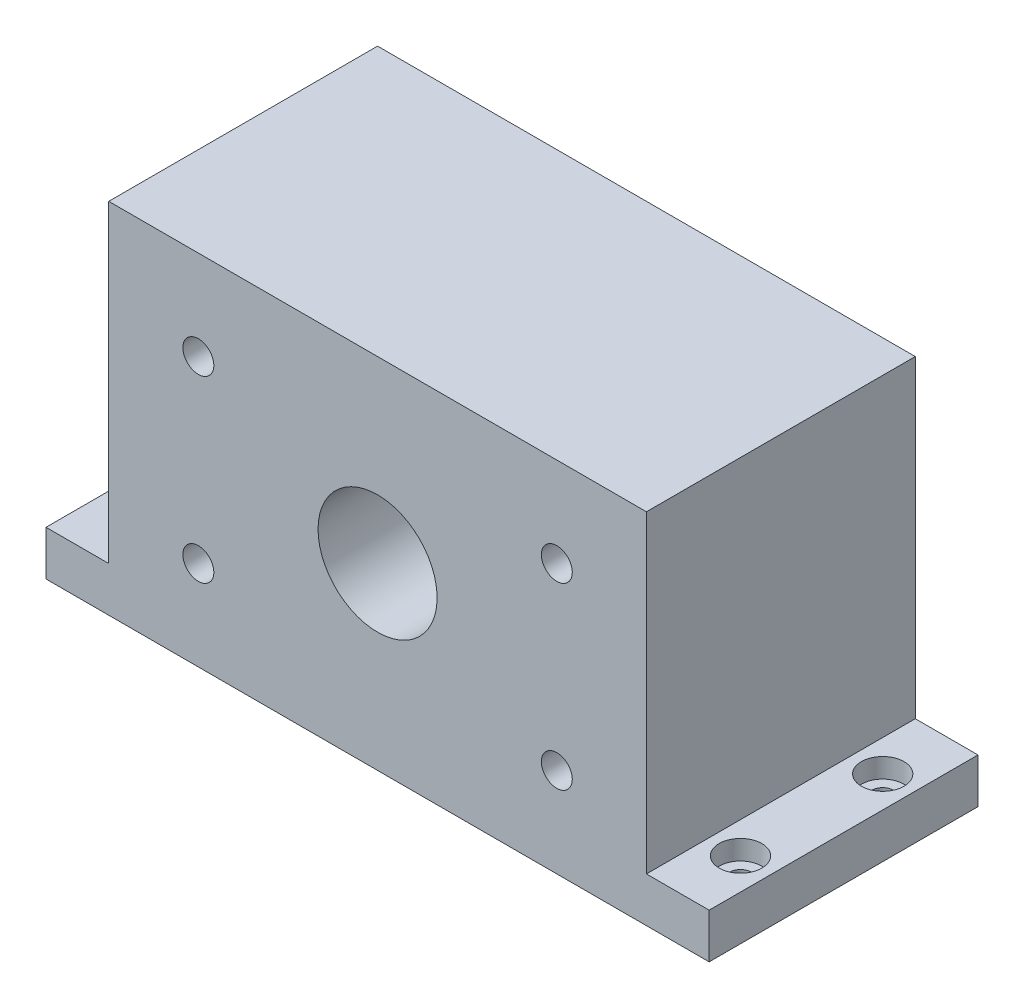
from build123d import *

# Parameters (mm, degrees)
SKETCH5_W                                      = 60
SKETCH5_H                                      = 30
BOSS_EXTRUDE3_DEPTH                            = 40
SKETCH7_W                                      = 40
SKETCH7_H                                      = 20
CUT_EXTRUDE1_DEPTH                             = 15
FILLET1_R                                      = 3
FILLET2_R                                      = 3
FILLET3_R                                      = 3
FILLET4_R                                      = 3
SKETCH9_W                                      = 30
SKETCH9_H                                      = 5
BOSS_EXTRUDE4_DEPTH                            = 7
SKETCH10_W                                     = 30
SKETCH10_H                                     = 5
BOSS_EXTRUDE5_DEPTH                            = 7
SKETCH12_R                                     = 2
CUT_EXTRUDE2_DEPTH                             = 10
SKETCH13_W                                     = 64
SKETCH13_H                                     = 20
CUT_EXTRUDE3_DEPTH                             = 1.5
CBORE_FOR_2_SOCKET_HEAD_CAP_SCREW1_D           = 2.4384
CBORE_FOR_2_SOCKET_HEAD_CAP_SCREW1_DEPTH       = 15
CBORE_FOR_2_SOCKET_HEAD_CAP_SCREW1_CBORE_D     = 4.7625
CBORE_FOR_2_SOCKET_HEAD_CAP_SCREW1_CBORE_DEPTH = 2.1844
CBORE_FOR_2_SOCKET_HEAD_CAP_SCREW1_TIP         = 0.732569267
F_2_56_TAPPED_HOLE2_D                          = 1.778
F_2_56_TAPPED_HOLE2_DEPTH                      = 15
F_2_56_TAPPED_HOLE2_TIP                        = 0.53416509
F_2_56_TAPPED_HOLE3_D                          = 1.778
F_2_56_TAPPED_HOLE3_DEPTH                      = 15
F_2_56_TAPPED_HOLE3_TIP                        = 0.53416509
CBORE_FOR_2_SOCKET_HEAD_CAP_SCREW3_D           = 2.4384
CBORE_FOR_2_SOCKET_HEAD_CAP_SCREW3_DEPTH       = 15
CBORE_FOR_2_SOCKET_HEAD_CAP_SCREW3_CBORE_D     = 4.7625
CBORE_FOR_2_SOCKET_HEAD_CAP_SCREW3_CBORE_DEPTH = 2.1844
CBORE_FOR_2_SOCKET_HEAD_CAP_SCREW3_TIP         = 0.732569267
F_8_32_TAPPED_HOLE1_D                          = 3.4544
F_8_32_TAPPED_HOLE1_DEPTH                      = 11
F_8_32_TAPPED_HOLE1_TIP                        = 1.037806461
F_0_535_40_TAPPED_HOLE1_D                      = 13.2842
SKETCH30_R                                     = 1.5
SKETCH30_R_2                                   = 3
CUT_EXTRUDE5_DEPTH                             = 10


with BuildPart() as part:
    # Sketch5 → Boss-Extrude3 (new body)
    with BuildSketch(Plane(origin=(0, 0, 0), x_dir=(1, 0, 0), z_dir=(0, 1, 0))):
        Rectangle(SKETCH5_W, SKETCH5_H)
    extrude(amount=BOSS_EXTRUDE3_DEPTH)

    # Sketch7 → Cut-Extrude1 (cut)
    with BuildSketch(Plane(origin=(0, 0, -15), x_dir=(-1, 0, 0), z_dir=(0, 0, -1))):
        with Locations((0, 20)):
            Rectangle(SKETCH7_W, SKETCH7_H)
    extrude(amount=-CUT_EXTRUDE1_DEPTH, mode=Mode.SUBTRACT)

    # Fillet1
    fillet1_edges = [part.edges().sort_by_distance(p)[0] for p in [
        (20, 10, -7.5),
    ]]
    fillet(fillet1_edges, radius=FILLET1_R)

    # Fillet2
    fillet2_edges = [part.edges().sort_by_distance(p)[0] for p in [
        (-20, 10, -7.5),
    ]]
    fillet(fillet2_edges, radius=FILLET2_R)

    # Fillet3
    fillet3_edges = [part.edges().sort_by_distance(p)[0] for p in [
        (-20, 30, -7.5),
    ]]
    fillet(fillet3_edges, radius=FILLET3_R)

    # Fillet4
    fillet4_edges = [part.edges().sort_by_distance(p)[0] for p in [
        (20, 30, -7.5),
    ]]
    fillet(fillet4_edges, radius=FILLET4_R)

    # Sketch9 → Boss-Extrude4 (add)
    with BuildSketch(Plane.ZY.offset(30)):
        with Locations((0, 2.5)):
            Rectangle(SKETCH9_W, SKETCH9_H)
    extrude(amount=BOSS_EXTRUDE4_DEPTH)

    # Sketch10 → Boss-Extrude5 (add)
    with BuildSketch(Plane(origin=(30, 0, 0), x_dir=(0, 0, -1), z_dir=(1, 0, 0))):
        with Locations((0, 2.5)):
            Rectangle(SKETCH10_W, SKETCH10_H)
    extrude(amount=BOSS_EXTRUDE5_DEPTH)

    # Sketch12 → Cut-Extrude2 (cut)
    with BuildSketch(Plane.ZY.offset(30)):
        with Locations((-7.531524718, 22.710545663)):
            Circle(SKETCH12_R)
    extrude(amount=-CUT_EXTRUDE2_DEPTH, mode=Mode.SUBTRACT)

    # Sketch13 → Cut-Extrude3 (cut)
    with BuildSketch(Plane(origin=(0, 0, 0), x_dir=(-1, 0, 0), z_dir=(0, -1, 0))):
        Rectangle(SKETCH13_W, SKETCH13_H)
    extrude(amount=-CUT_EXTRUDE3_DEPTH, mode=Mode.SUBTRACT)

    # CBORE for #2 Socket Head Cap Screw1
    with Locations(Plane(origin=(33.5, 5, 8), x_dir=(0, 0, 1), z_dir=(0, 1, 0))):
        with Locations((0, 0), (-15.84853595, 0.01844385)):
            CounterBoreHole(CBORE_FOR_2_SOCKET_HEAD_CAP_SCREW1_D / 2, CBORE_FOR_2_SOCKET_HEAD_CAP_SCREW1_CBORE_D / 2, CBORE_FOR_2_SOCKET_HEAD_CAP_SCREW1_CBORE_DEPTH, depth=CBORE_FOR_2_SOCKET_HEAD_CAP_SCREW1_DEPTH)
            with Locations((0, 0, -(CBORE_FOR_2_SOCKET_HEAD_CAP_SCREW1_DEPTH + CBORE_FOR_2_SOCKET_HEAD_CAP_SCREW1_TIP / 2))):  # 118° drill point
                Cone(0, CBORE_FOR_2_SOCKET_HEAD_CAP_SCREW1_D / 2, CBORE_FOR_2_SOCKET_HEAD_CAP_SCREW1_TIP, mode=Mode.SUBTRACT)

    # #2-56 Tapped Hole2
    with Locations(Plane(origin=(25, 36, -15), x_dir=(-1, 0, 0), z_dir=(0, 0, -1))):
        with Locations((0, 0), (0, -32), (50, -32)):
            Hole(F_2_56_TAPPED_HOLE2_D / 2, depth=F_2_56_TAPPED_HOLE2_DEPTH)
            with Locations((0, 0, -(F_2_56_TAPPED_HOLE2_DEPTH + F_2_56_TAPPED_HOLE2_TIP / 2))):  # 118° drill point
                Cone(0, F_2_56_TAPPED_HOLE2_D / 2, F_2_56_TAPPED_HOLE2_TIP, mode=Mode.SUBTRACT)

    # #2-56 Tapped Hole3
    with Locations(Plane(origin=(-25, 36, -15), x_dir=(-1, 0, 0), z_dir=(0, 0, -1))):
        with Locations((0, 0)):
            Hole(F_2_56_TAPPED_HOLE3_D / 2, depth=F_2_56_TAPPED_HOLE3_DEPTH)
            with Locations((0, 0, -(F_2_56_TAPPED_HOLE3_DEPTH + F_2_56_TAPPED_HOLE3_TIP / 2))):  # 118° drill point
                Cone(0, F_2_56_TAPPED_HOLE3_D / 2, F_2_56_TAPPED_HOLE3_TIP, mode=Mode.SUBTRACT)

    # CBORE for #2 Socket Head Cap Screw3
    with Locations(Plane(origin=(0, 5, 0), x_dir=(1, 0, 0), z_dir=(0, 1, 0))):
        with Locations((-33.5, 8), (-33.5, -8)):
            CounterBoreHole(CBORE_FOR_2_SOCKET_HEAD_CAP_SCREW3_D / 2, CBORE_FOR_2_SOCKET_HEAD_CAP_SCREW3_CBORE_D / 2, CBORE_FOR_2_SOCKET_HEAD_CAP_SCREW3_CBORE_DEPTH, depth=CBORE_FOR_2_SOCKET_HEAD_CAP_SCREW3_DEPTH)
            with Locations((0, 0, -(CBORE_FOR_2_SOCKET_HEAD_CAP_SCREW3_DEPTH + CBORE_FOR_2_SOCKET_HEAD_CAP_SCREW3_TIP / 2))):  # 118° drill point
                Cone(0, CBORE_FOR_2_SOCKET_HEAD_CAP_SCREW3_D / 2, CBORE_FOR_2_SOCKET_HEAD_CAP_SCREW3_TIP, mode=Mode.SUBTRACT)

    # #8-32 Tapped Hole1
    with Locations(Plane.XY.offset(15)):
        with Locations((-20, 30), (-20, 10), (20, 10), (20, 30)):
            Hole(F_8_32_TAPPED_HOLE1_D / 2, depth=F_8_32_TAPPED_HOLE1_DEPTH)
            with Locations((0, 0, -(F_8_32_TAPPED_HOLE1_DEPTH + F_8_32_TAPPED_HOLE1_TIP / 2))):  # 118° drill point
                Cone(0, F_8_32_TAPPED_HOLE1_D / 2, F_8_32_TAPPED_HOLE1_TIP, mode=Mode.SUBTRACT)

    # 0.535-40 Tapped Hole1 (through all)
    with Locations(Plane(origin=(0, 20, 0), x_dir=(-1, 0, 0), z_dir=(0, 0, -1))):
        with Locations((0, 0)):
            Hole(F_0_535_40_TAPPED_HOLE1_D / 2)

    # Sketch30 → Cut-Extrude5 (cut)
    with BuildSketch(Plane(origin=(0, 0, 0), x_dir=(-1, 0, 0), z_dir=(0, 0, -1))):
        with Locations((-12.5, 20)):
            Circle(SKETCH30_R)
        with Locations((12.5, 20)):
            Circle(SKETCH30_R_2)
    extrude(amount=-CUT_EXTRUDE5_DEPTH, mode=Mode.SUBTRACT)


solid = part.part
